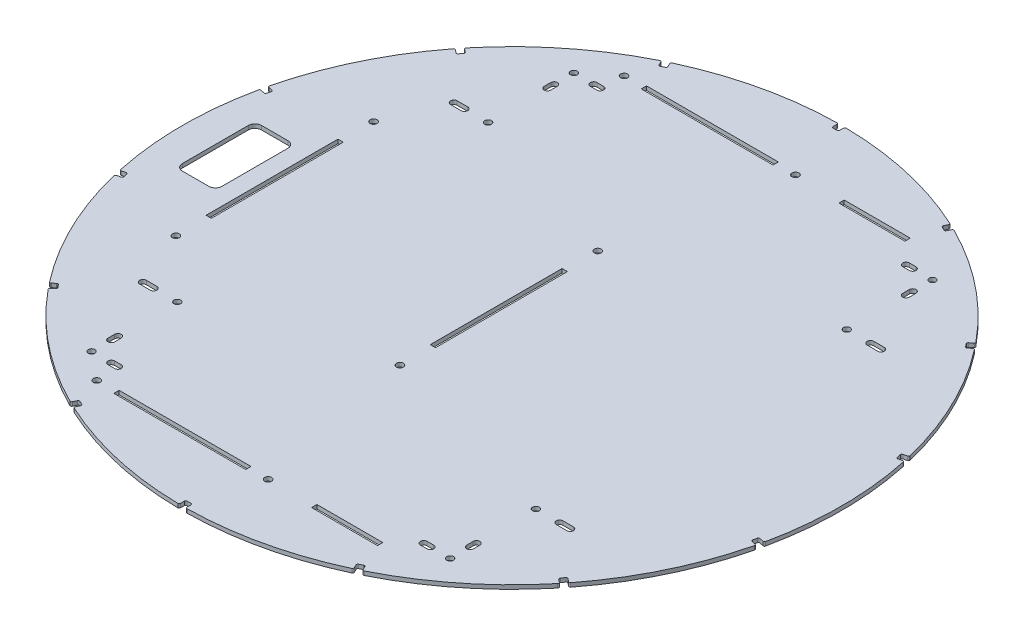
from build123d import *

# Parameters (mm, degrees)
SKETCH1_R                = 250
BOSS_EXTRUDE1_DEPTH      = 3
CUT_EXTRUDE5_DEPTH       = 4
FILLET1_R                = 1
CIRPATTERN1_COUNT        = 14
FILLET1_OF_CIRPATTERN1_R = 1
SKETCH17_W               = 4
SKETCH17_H               = 100
CUT_EXTRUDE11_DEPTH      = 10
SKETCH18_R               = 2.6
CUT_EXTRUDE12_DEPTH      = 10
CUT_EXTRUDE14_DEPTH      = 14
SKETCH21_R               = 2.6
SKETCH21_W               = 100
SKETCH21_H               = 4
CUT_EXTRUDE15_DEPTH      = 14
SKETCH22_R               = 2.5
CUT_EXTRUDE16_DEPTH      = 14
CUT_EXTRUDE17_DEPTH      = 14
SKETCH25_W               = 50
SKETCH25_H               = 4
CUT_EXTRUDE18_DEPTH      = 4
CUT_EXTRUDE19_DEPTH      = 4


with BuildPart() as part:
    # Sketch1 → Boss-Extrude1 (new body)
    with BuildSketch(Plane(origin=(0, 0, 0), x_dir=(1, 0, 0), z_dir=(0, 1, 0))):
        Circle(SKETCH1_R)
    extrude(amount=BOSS_EXTRUDE1_DEPTH)

    # Sketch11 → Cut-Extrude5 (cut)
    with BuildSketch(Plane(origin=(0, 3, 0), x_dir=(1, 0, 0), z_dir=(0, 1, 0))):
        with BuildLine():
            Line((1.5, 245), (-1.5, 245))
            ThreePointArc((-1.5, 245), (-2.207106781, 245.292893219), (-2.5, 246))
            Line((-2.5, 246), (-2.5, 255))
            Line((-2.5, 255), (2.5, 255))
            Line((2.5, 255), (2.5, 246))
            ThreePointArc((2.5, 246), (2.207106781, 245.292893219), (1.5, 245))
        make_face()
    cut_extrude5 = extrude(amount=-CUT_EXTRUDE5_DEPTH, mode=Mode.SUBTRACT)

    # Fillet1
    fillet1_edges = [part.edges().sort_by_distance(p)[0] for p in [
        (2.5, 1.5, -249.987499687),
        (-2.5, 1.5, -249.987499687),
    ]]
    fillet(fillet1_edges, radius=FILLET1_R)

    # CirPattern1: Cut-Extrude5 ×14 about axis
    cirpattern1_axis = Axis((0, 3, 0), (0, -1, 0))
    for i in range(1, CIRPATTERN1_COUNT):
        add(cut_extrude5.rotate(cirpattern1_axis, i * 360 / CIRPATTERN1_COUNT), mode=Mode.SUBTRACT)

    # Fillet1 of CirPattern1
    fillet1_of_cirpattern1_edges = [part.edges().sort_by_distance(p)[0] for p in [
        (110.717933267, 1.5, -224.146245235),
        (106.213088927, 1.5, -226.315663931),
        (197.006821984, 1.5, -153.910077941),
        (193.889372974, 1.5, -157.819235353),
        (244.276093477, 1.5, -53.190132127),
        (243.163488807, 1.5, -58.064771688),
        (243.163488807, 1.5, 58.064771688),
        (244.276093477, 1.5, 53.190132127),
        (193.889372974, 1.5, 157.819235353),
        (197.006821984, 1.5, 153.910077941),
        (106.213088927, 1.5, 226.315663931),
        (110.717933267, 1.5, 224.146245235),
        (-2.5, 1.5, 249.987499687),
        (2.5, 1.5, 249.987499687),
        (-110.717933267, 1.5, 224.146245235),
        (-106.213088927, 1.5, 226.315663931),
        (-197.006821984, 1.5, 153.910077941),
        (-193.889372974, 1.5, 157.819235353),
        (-244.276093477, 1.5, 53.190132127),
        (-243.163488807, 1.5, 58.064771688),
        (-243.163488807, 1.5, -58.064771688),
        (-244.276093477, 1.5, -53.190132127),
        (-193.889372974, 1.5, -157.819235353),
        (-197.006821984, 1.5, -153.910077941),
        (-106.213088927, 1.5, -226.315663931),
        (-110.717933267, 1.5, -224.146245235),
    ]]
    fillet(fillet1_of_cirpattern1_edges, radius=FILLET1_OF_CIRPATTERN1_R)

    # Sketch17 → Cut-Extrude11 (cut)
    with BuildSketch(Plane(origin=(0, 3, 0), x_dir=(1, 0, 0), z_dir=(0, 1, 0))):
        with Locations((-10, 0)):
            Rectangle(SKETCH17_W, SKETCH17_H)
        with Locations((-180, 0)):
            Rectangle(SKETCH17_W, SKETCH17_H)
    extrude(amount=-CUT_EXTRUDE11_DEPTH, mode=Mode.SUBTRACT)

    # Sketch18 → Cut-Extrude12 (cut)
    with BuildSketch(Plane(origin=(0, 3, 0), x_dir=(1, 0, 0), z_dir=(0, 1, 0))):
        with Locations((-180, 75)):
            Circle(SKETCH18_R)
        with Locations((-180, -75)):
            Circle(SKETCH18_R)
        with Locations((-10, 75)):
            Circle(SKETCH18_R)
        with Locations((-10, -75)):
            Circle(SKETCH18_R)
    extrude(amount=-CUT_EXTRUDE12_DEPTH, mode=Mode.SUBTRACT)

    # Sketch20 → Cut-Extrude14 (cut)
    with BuildSketch(Plane.XZ):
        with BuildLine():
            Line((-162, -115.4), (-154, -115.4))
            ThreePointArc((-154, -115.4), (-151.5, -117.9), (-154, -120.4))
            Line((-154, -120.4), (-162, -120.4))
            ThreePointArc((-162, -120.4), (-164.5, -117.9), (-162, -115.4))
        make_face()
        with BuildLine():
            Line((162, -115.4), (154, -115.4))
            ThreePointArc((154, -115.4), (151.5, -117.9), (154, -120.4))
            Line((154, -120.4), (162, -120.4))
            ThreePointArc((162, -120.4), (164.5, -117.9), (162, -115.4))
        make_face()
        with BuildLine():
            Line((162, 115.4), (154, 115.4))
            ThreePointArc((154, 115.4), (151.5, 117.9), (154, 120.4))
            Line((154, 120.4), (162, 120.4))
            ThreePointArc((162, 120.4), (164.5, 117.9), (162, 115.4))
        make_face()
        with BuildLine():
            Line((-162, 115.4), (-154, 115.4))
            ThreePointArc((-154, 115.4), (-151.5, 117.9), (-154, 120.4))
            Line((-154, 120.4), (-162, 120.4))
            ThreePointArc((-162, 120.4), (-164.5, 117.9), (-162, 115.4))
        make_face()
    extrude(amount=-CUT_EXTRUDE14_DEPTH, mode=Mode.SUBTRACT)

    # Sketch21 → Cut-Extrude15 (cut)
    with BuildSketch(Plane(origin=(0, 3, 0), x_dir=(1, 0, 0), z_dir=(0, 1, 0))):
        with Locations((-115, 200)):
            Circle(SKETCH21_R)
        with Locations((15, 200)):
            Circle(SKETCH21_R)
        with Locations((15, -200)):
            Circle(SKETCH21_R)
        with Locations((-115, -200)):
            Circle(SKETCH21_R)
        with Locations((-50, 200)):
            Rectangle(SKETCH21_W, SKETCH21_H)
        with Locations((-50, -200)):
            Rectangle(SKETCH21_W, SKETCH21_H)
    extrude(amount=-CUT_EXTRUDE15_DEPTH, mode=Mode.SUBTRACT)

    # Sketch22 → Cut-Extrude16 (cut)
    with BuildSketch(Plane(origin=(0, 3, 0), x_dir=(1, 0, 0), z_dir=(0, 1, 0))):
        with Locations((-136, -117.9)):
            Circle(SKETCH22_R)
        with Locations((-136, 117.9)):
            Circle(SKETCH22_R)
        with Locations((136, 117.9)):
            Circle(SKETCH22_R)
        with Locations((136, -117.9)):
            Circle(SKETCH22_R)
        with Locations((-136, 182.9)):
            Circle(SKETCH22_R)
        with Locations((136, 182.9)):
            Circle(SKETCH22_R)
        with Locations((-136, -182.9)):
            Circle(SKETCH22_R)
        with Locations((136, -182.9)):
            Circle(SKETCH22_R)
    extrude(amount=-CUT_EXTRUDE16_DEPTH, mode=Mode.SUBTRACT)

    # Sketch24 → Cut-Extrude17 (cut)
    with BuildSketch(Plane.XZ):
        with BuildLine():
            Line((-200, -30), (-220, -30))
            ThreePointArc((-220, -30), (-223.535533906, -28.535533906), (-225, -25))
            Line((-225, -25), (-225, 25))
            ThreePointArc((-225, 25), (-223.535533906, 28.535533906), (-220, 30))
            Line((-220, 30), (-200, 30))
            ThreePointArc((-200, 30), (-196.464466094, 28.535533906), (-195, 25))
            Line((-195, 25), (-195, -25))
            ThreePointArc((-195, -25), (-196.464466094, -28.535533906), (-200, -30))
        make_face()
    extrude(amount=-CUT_EXTRUDE17_DEPTH, mode=Mode.SUBTRACT)

    # Sketch25 → Cut-Extrude18 (cut)
    with BuildSketch(Plane(origin=(0, 3, 0), x_dir=(1, 0, 0), z_dir=(0, 1, 0))):
        with Locations((75, 200)):
            Rectangle(SKETCH25_W, SKETCH25_H)
        with Locations((75, -200)):
            Rectangle(SKETCH25_W, SKETCH25_H)
    extrude(amount=-CUT_EXTRUDE18_DEPTH, mode=Mode.SUBTRACT)

    # Sketch26 → Cut-Extrude19 (cut)
    with BuildSketch(Plane(origin=(0, 3, 0), x_dir=(1, 0, 0), z_dir=(0, 1, 0))):
        with BuildLine():
            Line((-138.5, 162.9), (-138.5, 167.9))
            ThreePointArc((-138.5, 167.9), (-136, 170.4), (-133.5, 167.9))
            Line((-133.5, 167.9), (-133.5, 162.9))
            ThreePointArc((-133.5, 162.9), (-136, 160.4), (-138.5, 162.9))
        make_face()
        with BuildLine():
            Line((-116, 180.4), (-121, 180.4))
            ThreePointArc((-121, 180.4), (-123.5, 182.9), (-121, 185.4))
            Line((-121, 185.4), (-116, 185.4))
            ThreePointArc((-116, 185.4), (-113.5, 182.9), (-116, 180.4))
        make_face()
        with BuildLine():
            Line((116, 180.4), (121, 180.4))
            ThreePointArc((121, 180.4), (123.5, 182.9), (121, 185.4))
            Line((121, 185.4), (116, 185.4))
            ThreePointArc((116, 185.4), (113.5, 182.9), (116, 180.4))
        make_face()
        with BuildLine():
            Line((138.5, 162.9), (138.5, 167.9))
            ThreePointArc((138.5, 167.9), (136, 170.4), (133.5, 167.9))
            Line((133.5, 167.9), (133.5, 162.9))
            ThreePointArc((133.5, 162.9), (136, 160.4), (138.5, 162.9))
        make_face()
        with BuildLine():
            Line((116, -180.4), (121, -180.4))
            ThreePointArc((121, -180.4), (123.5, -182.9), (121, -185.4))
            Line((121, -185.4), (116, -185.4))
            ThreePointArc((116, -185.4), (113.5, -182.9), (116, -180.4))
        make_face()
        with BuildLine():
            Line((138.5, -162.9), (138.5, -167.9))
            ThreePointArc((138.5, -167.9), (136, -170.4), (133.5, -167.9))
            Line((133.5, -167.9), (133.5, -162.9))
            ThreePointArc((133.5, -162.9), (136, -160.4), (138.5, -162.9))
        make_face()
        with BuildLine():
            Line((-138.5, -162.9), (-138.5, -167.9))
            ThreePointArc((-138.5, -167.9), (-136, -170.4), (-133.5, -167.9))
            Line((-133.5, -167.9), (-133.5, -162.9))
            ThreePointArc((-133.5, -162.9), (-136, -160.4), (-138.5, -162.9))
        make_face()
        with BuildLine():
            Line((-116, -180.4), (-121, -180.4))
            ThreePointArc((-121, -180.4), (-123.5, -182.9), (-121, -185.4))
            Line((-121, -185.4), (-116, -185.4))
            ThreePointArc((-116, -185.4), (-113.5, -182.9), (-116, -180.4))
        make_face()
    extrude(amount=-CUT_EXTRUDE19_DEPTH, mode=Mode.SUBTRACT)


solid = part.part
